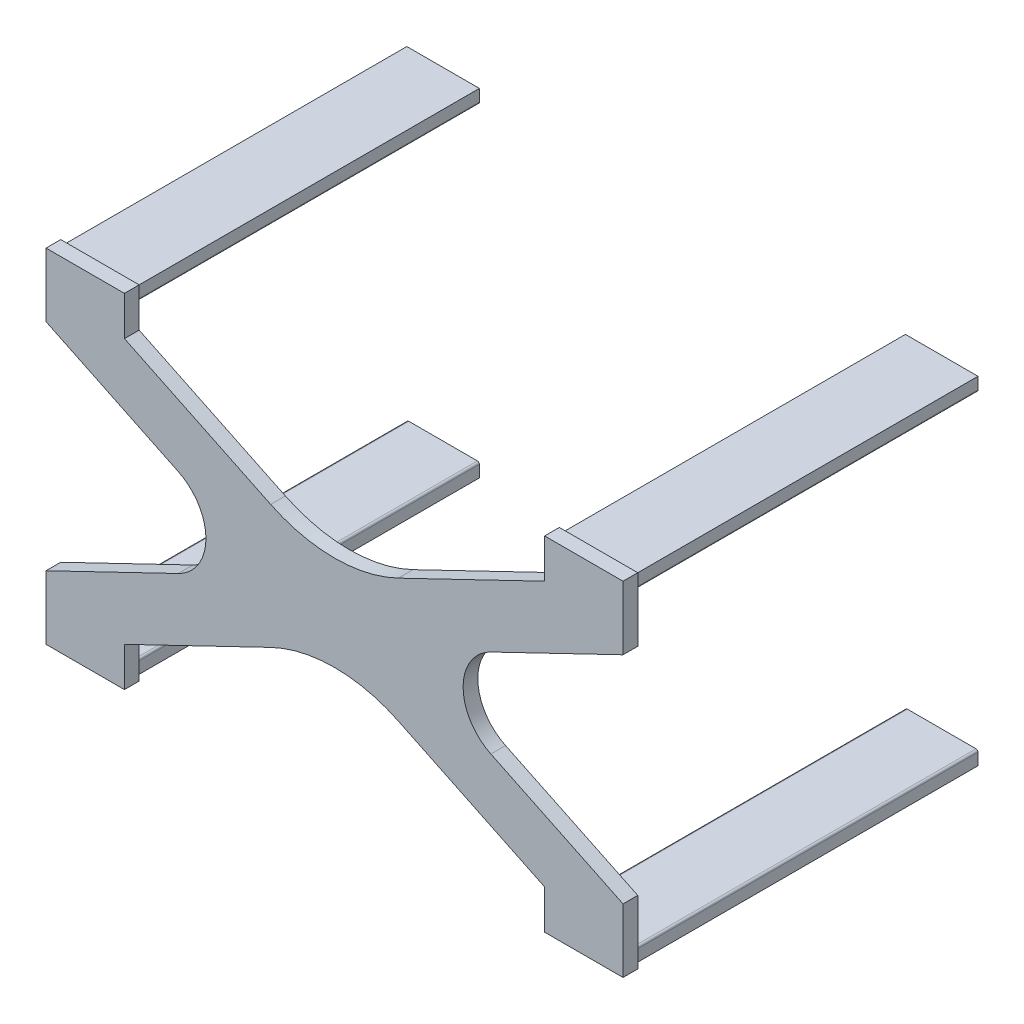
from build123d import *

# Parameters (mm, degrees)
EXTRUDE_1_DEPTH   = 3
FILLET_1_R        = 30
FILLET_2_R        = 10
EXTRUDE_2_DEPTH   = 70
EXTRUDE_2_2_DEPTH = 70
EXTRUDE_2_3_DEPTH = 70
EXTRUDE_2_4_DEPTH = 70


with BuildPart() as part:
    # Эскиз1 → Бобышка-Вытянуть1 (new body)
    with BuildSketch(Plane.XY):
        Polygon((-58.85, -35), (-42.85, -35), (-42.85, -27), (0, -6.354473943), (42.85, -27), (42.85, -35), (58.85, -35), (58.85, -22), (13.18877551, 0), (58.85, 22), (58.85, 35), (42.85, 35), (42.85, 27), (0, 6.354473943), (-42.85, 27), (-42.85, 35), (-58.85, 35), (-58.85, 22), (-13.18877551, 0), (-58.85, -22), align=None)
    extrude(amount=EXTRUDE_1_DEPTH)

    # Скругление1
    fillet_1_edges = [part.edges().sort_by_distance(p)[0] for p in [
        (0, -6.354473943, 1.5),
        (0, 6.354473943, 1.5),
    ]]
    fillet(fillet_1_edges, radius=FILLET_1_R)

    # Скругление2
    fillet_2_edges = [part.edges().sort_by_distance(p)[0] for p in [
        (13.18877551, 0, 1.5),
        (-13.18877551, 0, 1.5),
    ]]
    fillet(fillet_2_edges, radius=FILLET_2_R)


with BuildPart() as body_2:
    # Эскиз2 → Бобышка-Вытянуть2 (new body)
    with BuildSketch(Plane(origin=(0, 0, 0), x_dir=(-1, 0, 0), z_dir=(0, 0, -1))):
        with BuildLine():
            Line((-58.25, 34.4), (-58.25, 32))
            ThreePointArc((-58.25, 32), (-58.132842712, 31.717157288), (-57.85, 31.6))
            Line((-57.85, 31.6), (-43.85, 31.6))
            ThreePointArc((-43.85, 31.6), (-43.567157288, 31.717157288), (-43.45, 32))
            Line((-43.45, 32), (-43.45, 34.4))
            Line((-43.45, 34.4), (-58.25, 34.4))
        make_face()
    extrude(amount=EXTRUDE_2_DEPTH)


with BuildPart() as body_3:
    # Эскиз2 → Extrude 2 2 (new body)
    with BuildSketch(Plane(origin=(0, 0, 0), x_dir=(-1, 0, 0), z_dir=(0, 0, -1))):
        with BuildLine():
            Line((-43.85, -31.6), (-57.85, -31.6))
            ThreePointArc((-57.85, -31.6), (-58.132842712, -31.717157288), (-58.25, -32))
            Line((-58.25, -32), (-58.25, -34.4))
            Line((-58.25, -34.4), (-43.45, -34.4))
            Line((-43.45, -34.4), (-43.45, -32))
            ThreePointArc((-43.45, -32), (-43.567157288, -31.717157288), (-43.85, -31.6))
        make_face()
    extrude(amount=EXTRUDE_2_2_DEPTH)


with BuildPart() as body_4:
    # Эскиз2 → Extrude 2 3 (new body)
    with BuildSketch(Plane(origin=(0, 0, 0), x_dir=(-1, 0, 0), z_dir=(0, 0, -1))):
        with BuildLine():
            Line((43.45, -34.4), (58.25, -34.4))
            Line((58.25, -34.4), (58.25, -32))
            ThreePointArc((58.25, -32), (58.132842712, -31.717157288), (57.85, -31.6))
            Line((57.85, -31.6), (43.85, -31.6))
            ThreePointArc((43.85, -31.6), (43.567157288, -31.717157288), (43.45, -32))
            Line((43.45, -32), (43.45, -34.4))
        make_face()
    extrude(amount=EXTRUDE_2_3_DEPTH)


with BuildPart() as body_5:
    # Эскиз2 → Extrude 2 4 (new body)
    with BuildSketch(Plane(origin=(0, 0, 0), x_dir=(-1, 0, 0), z_dir=(0, 0, -1))):
        with BuildLine():
            Line((43.45, 34.4), (43.45, 32))
            ThreePointArc((43.45, 32), (43.567157288, 31.717157288), (43.85, 31.6))
            Line((43.85, 31.6), (57.85, 31.6))
            ThreePointArc((57.85, 31.6), (58.132842712, 31.717157288), (58.25, 32))
            Line((58.25, 32), (58.25, 34.4))
            Line((58.25, 34.4), (43.45, 34.4))
        make_face()
    extrude(amount=EXTRUDE_2_4_DEPTH)


solid = Compound([part.part, body_2.part, body_3.part, body_4.part, body_5.part])
